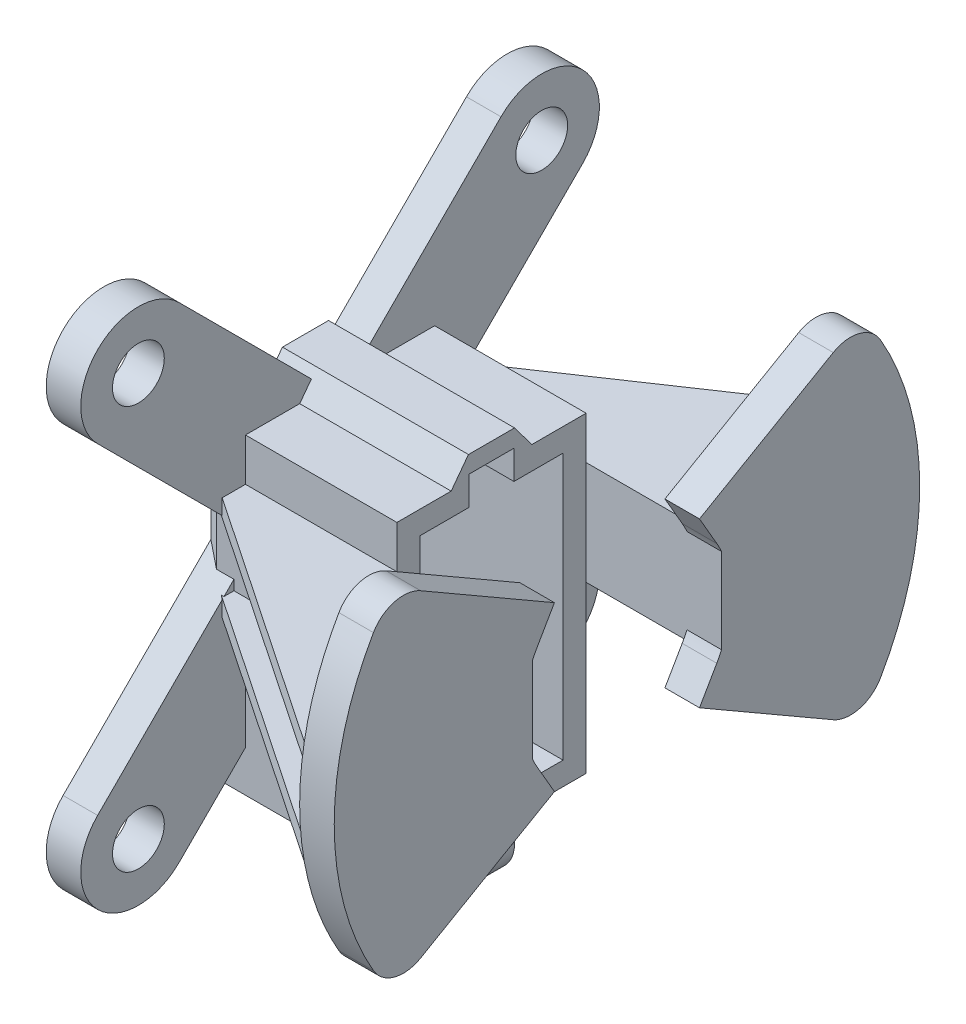
from build123d import *

# Parameters (mm, degrees)
MICRO_START                                  = -46.670460781
MICRO_SERVO_MOUNT_BASE_PART_CAMERA_TUR_DEPTH = 16.1417
MICRO_START_2                                = 12.849763649
MICRO_SERVO_MOUNT_BASE_PART_CAMERA_3_O_R     = 1.2
MICRO_SERVO_MOUNT_BASE_PART_CAMERA_3_DEPTH   = 16.4158
BOSS_EXTRUDE1_DEPTH                          = 4.5
CUT_EXTRUDE1_DEPTH                           = 3
BOSS_EXTRUDE2_DEPTH                          = 3
BOSS_EXTRUDE3_DEPTH                          = 3
FILLET1_R                                    = 3
BOSS_EXTRUDE4_DEPTH                          = 3
CUT_EXTRUDE2_DEPTH                           = 45.721836893
F_8_CLEARANCE_HOLE1_D                        = 4.4958


with BuildPart() as part:
    # Micro Servo Mount Base Part - Camera Tur: read off the stored shape, not the designer's step
    # Micro Servo Mount Base Part - Camera 2 → Micro Servo Mount Base Part - Camera Tur (new body)
    with BuildSketch(Plane.YZ.offset(MICRO_START)):
        Polygon((-18.758887412, 21.257663649), (-11.608887412, 21.257663649), (-11.608887412, 27.265563649), (11.462212588, 27.265563649), (11.462212588, 23.005463649), (13.962212588, 23.005463649), (13.962212588, 19.109863649), (11.462212588, 19.109863649), (11.462212588, 14.849763649), (-11.608887412, 14.849763649), (-11.608887412, 20.857663649), (-18.758887412, 20.857663649), (-18.758887412, 19.057663649), (-13.608887412, 19.057663649), (-13.608887412, 12.849763649), (13.462212588, 12.849763649), (13.462212588, 17.557663649), (15.462212588, 19.057663649), (15.462212588, 23.057663649), (13.462212588, 24.557663649), (13.462212588, 29.265563649), (-13.608887412, 29.265563649), (-13.608887412, 23.057663649), (-18.758887412, 23.057663649), align=None)
    extrude(amount=MICRO_SERVO_MOUNT_BASE_PART_CAMERA_TUR_DEPTH)

    # Micro Servo Mount Base Part - Camera 3 o → Micro Servo Mount Base Part - Camera 3 (cut)
    with BuildSketch(Plane.XY.offset(MICRO_START_2)):
        with BuildLine():
            Line((-46.670460781, -18.758887412), (-43.670460781, -18.758887412))
            ThreePointArc((-43.670460781, -18.758887412), (-45.791781124, -17.880207755), (-46.670460781, -15.758887412))
            Line((-46.670460781, -15.758887412), (-46.670460781, -18.758887412))
        make_face()
        with BuildLine():
            ThreePointArc((-30.528760781, -15.758887412), (-31.407440438, -17.880207755), (-33.528760781, -18.758887412))
            Line((-33.528760781, -18.758887412), (-30.528760781, -18.758887412))
            Line((-30.528760781, -18.758887412), (-30.528760781, -15.758887412))
        make_face()
        with Locations((-43.670460781, -15.758887412)):
            Circle(MICRO_SERVO_MOUNT_BASE_PART_CAMERA_3_O_R)
        with Locations((-33.528760781, -15.758887412)):
            Circle(MICRO_SERVO_MOUNT_BASE_PART_CAMERA_3_O_R)
    extrude(amount=MICRO_SERVO_MOUNT_BASE_PART_CAMERA_3_DEPTH, mode=Mode.SUBTRACT)


with BuildPart() as part_1:
    # Micro Servo Mount Base Part - Camera 4: read off the stored shape, not the designer's step
    # Micro Servo Mount Base Part - Camera 4: moved
    add(part.part.moved(Location((46.6704608, -5.2543126, -21.0576636))))

    # Sketch7 → Boss-Extrude1 (add, symmetric)
    with BuildSketch(Plane(origin=(0, 0, 0), x_dir=(1, 0, 0), z_dir=(0, 1, 0))):
        Polygon((0, 8.2079), (27.8955, 8.2079), (27.8955, 25), (24.8955, 25), align=None)
        Polygon((24.8955, -25), (0, -8.2079), (27.8955, -8.2079), (27.8955, -25), align=None)
    extrude(amount=BOSS_EXTRUDE1_DEPTH, both=True)

    # Sketch9 → Cut-Extrude1 (cut, symmetric)
    with BuildSketch(Plane(origin=(0, 0, 0), x_dir=(1, 0, 0), z_dir=(0, 1, 0))):
        Polygon((1.482572162, -9.2079), (24.8955, -25), (24.8955, -9.2079), align=None)
        Polygon((24.8955, 9.2079), (1.482572162, 9.2079), (24.8955, 25), align=None)
    extrude(amount=CUT_EXTRUDE1_DEPTH, both=True, mode=Mode.SUBTRACT)

    # Sketch10 → Boss-Extrude2 (add)
    with BuildSketch(Plane(origin=(27.8955, 0, 0), x_dir=(0, 0, -1), z_dir=(1, 0, 0))):
        with BuildLine():
            Line((-21.9985795, 12.700885796), (-7.794228634, 4.5))
            ThreePointArc((-7.794228634, 4.5), (-9, 0), (-7.794228634, -4.5))
            Line((-7.794228634, -4.5), (-21.9985795, -12.700885796))
            ThreePointArc((-21.9985795, -12.700885796), (-25.401771592, 0), (-21.9985795, 12.700885796))
        make_face()
        with BuildLine():
            Line((7.794228634, 4.5), (21.9985795, 12.700885796))
            ThreePointArc((21.9985795, 12.700885796), (25.401771592, 0), (21.9985795, -12.700885796))
            Line((21.9985795, -12.700885796), (7.794228634, -4.5))
            ThreePointArc((7.794228634, -4.5), (9, 0), (7.794228634, 4.5))
        make_face()
    extrude(amount=-BOSS_EXTRUDE2_DEPTH)

    # Sketch11 → Boss-Extrude3 (add)
    with BuildSketch(Plane(origin=(27.8955, 0, 0), x_dir=(0, 0, -1), z_dir=(1, 0, 0))):
        Polygon((-21.9985795, 12.700885796), (-7.794228634, 4.5), (-6.294228634, 7.098076211), (-20.4985795, 15.298962007), align=None)
        Polygon((7.794228634, 4.5), (6.294228634, 7.098076211), (20.4985795, 15.298962007), (21.9985795, 12.700885796), align=None)
        Polygon((21.9985795, -12.700885796), (7.794228634, -4.5), (6.294228634, -7.098076211), (20.4985795, -15.298962007), align=None)
        Polygon((-7.794228634, -4.5), (-6.294228634, -7.098076211), (-20.4985795, -15.298962007), (-21.9985795, -12.700885796), align=None)
    extrude(amount=-BOSS_EXTRUDE3_DEPTH)

    # Fillet1
    fillet1_edges = [part_1.edges().sort_by_distance(p)[0] for p in [
        (26.3955, -15.298962007, -20.4985795),
        (26.3955, -15.298962007, 20.4985795),
        (26.3955, 15.298962007, -20.4985795),
        (26.3955, 15.298962007, 20.4985795),
    ]]
    fillet(fillet1_edges, radius=FILLET1_R - 0.0001)  # a hair under: the kernel refuses the full size

    # Sketch13 → Boss-Extrude4 (add)
    with BuildSketch(Plane.ZY):
        with BuildLine():
            Line((13.964466094, -21.035533906), (8.2079, -15.278967812))
            Line((8.2079, -15.278967812), (8.2079, -1.136832188))
            Line((8.2079, -1.136832188), (21.035533906, -13.964466094))
            ThreePointArc((21.035533906, -13.964466094), (21.035533906, -21.035533906), (13.964466094, -21.035533906))
        make_face()
        with BuildLine():
            Line((-13.964466094, 21.035533906), (-1.136832188, 8.2079))
            Line((-1.136832188, 8.2079), (-8.2079, 8.2079))
            Line((-8.2079, 8.2079), (-8.2079, 1.136832188))
            Line((-8.2079, 1.136832188), (-21.035533906, 13.964466094))
            ThreePointArc((-21.035533906, 13.964466094), (-21.035533906, 21.035533906), (-13.964466094, 21.035533906))
        make_face()
        with BuildLine():
            Line((1.136832188, 8.2079), (13.964466094, 21.035533906))
            ThreePointArc((13.964466094, 21.035533906), (21.035533906, 21.035533906), (21.035533906, 13.964466094))
            Line((21.035533906, 13.964466094), (8.2079, 1.136832188))
            Line((8.2079, 1.136832188), (8.2079, 8.2079))
            Line((8.2079, 8.2079), (1.136832188, 8.2079))
        make_face()
        with BuildLine():
            Line((-8.2079, -1.136832188), (-21.035533906, -13.964466094))
            ThreePointArc((-21.035533906, -13.964466094), (-21.035533906, -21.035533906), (-13.964466094, -21.035533906))
            Line((-13.964466094, -21.035533906), (-8.2079, -15.278967812))
            Line((-8.2079, -15.278967812), (-8.2079, -1.136832188))
        make_face()
    extrude(amount=-BOSS_EXTRUDE4_DEPTH)

    # Sketch14 → Cut-Extrude2 (cut, through all)
    with BuildSketch(Plane.ZY):
        Polygon((-1.9478, 6.2079), (-6.2079, 6.2079), (-6.2079, -16.8632), (6.2079, -16.8632), (6.2079, 6.2079), (1.9478, 6.2079), (1.9478, 8.7079), (-1.9478, 8.7079), align=None)
    extrude(amount=-CUT_EXTRUDE2_DEPTH, mode=Mode.SUBTRACT)

    # #8 Clearance Hole1 (through all)
    with Locations(Plane(origin=(3, 0, 0), x_dir=(0, 0, -1), z_dir=(1, 0, 0))):
        with Locations((-17.5, 17.5), (17.5, 17.5), (17.5, -17.5), (-17.5, -17.5)):
            Hole(F_8_CLEARANCE_HOLE1_D / 2)


solid = part_1.part
